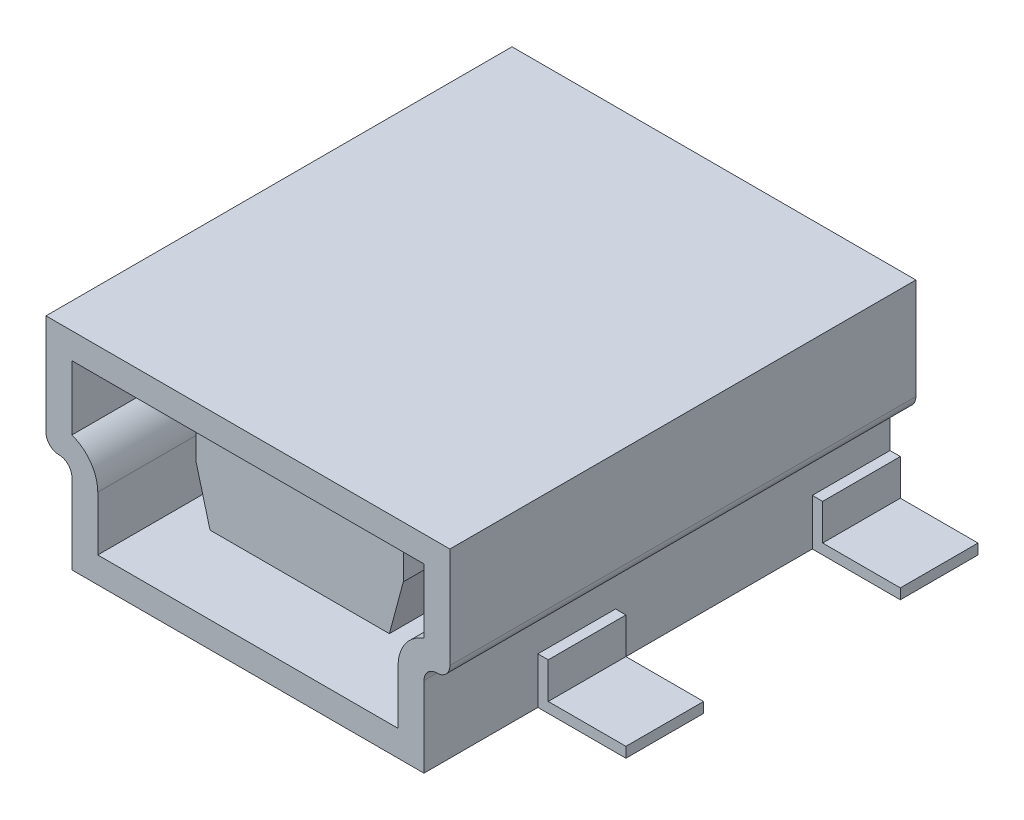
from build123d import *

# Parameters (mm, degrees)
SKETCH_1_W          = 7.8
SKETCH_1_H          = 4
EXTRUDE_1_DEPTH     = 9
SKETCH_2_W          = 0.5
SKETCH_2_H          = 9
CUT_EXTRUDE_1_DEPTH = 1.8
FILLET_START        = -1
FILLET_1_DEPTH      = 11
FILLET_1_2_DEPTH    = 9
SHELL_1_T           = -0.5
SKETCH_3_W          = 4
SKETCH_3_H          = 1.5
EXTRUDE_2_DEPTH     = 7.5
CHAMFER_1_SIZE      = 1
CHAMFER_1_SIZE2     = 0.267949192
CHAMFER_2_SIZE      = 1
CHAMFER_2_SIZE2     = 0.267949192
SKETCH_4_W          = 1.5
SKETCH_4_H          = 0.896951392
EXTRUDE_3_DEPTH     = 0.2
SKETCH_5_W          = 1.5
SKETCH_5_H          = 0.2
EXTRUDE_4_DEPTH     = 1.5


with BuildPart() as part:
    # 草图1 → 拉伸1 (new body)
    with BuildSketch(Plane.XY):
        Rectangle(SKETCH_1_W, SKETCH_1_H)
    extrude(amount=EXTRUDE_1_DEPTH)

    # 草图2 → 切除-拉伸1 (cut)
    with BuildSketch(Plane.XZ.offset(2)):
        with Locations((-3.65, 4.5)):
            Rectangle(SKETCH_2_W, SKETCH_2_H)
        with Locations((3.65, 4.5)):
            Rectangle(SKETCH_2_W, SKETCH_2_H)
    extrude(amount=-CUT_EXTRUDE_1_DEPTH, mode=Mode.SUBTRACT)

    # 圆角1: read off the stored shape, not the designer's step
    # 圆角1 outline → 圆角1 (cut)
    with BuildSketch(Plane.XY.offset(FILLET_START)):
        with BuildLine():
            ThreePointArc((3.9, 0.05), (3.826776695, -0.126776695), (3.65, -0.2))
            Line((3.65, -0.2), (3.9, -0.2))
            Line((3.9, -0.2), (3.9, 0.05))
        make_face()
        with BuildLine():
            ThreePointArc((-3.65, -0.2), (-3.826776695, -0.126776695), (-3.9, 0.05))
            Line((-3.9, 0.05), (-3.9, -0.2))
            Line((-3.9, -0.2), (-3.65, -0.2))
        make_face()
    extrude(amount=FILLET_1_DEPTH, mode=Mode.SUBTRACT)

    # Fillet 1 2 outline → Fillet 1 2 (add)
    with BuildSketch(Plane.XY):
        with BuildLine():
            Line((3.4, -0.2), (3.4, -0.45))
            ThreePointArc((3.4, -0.45), (3.473223305, -0.273223305), (3.65, -0.2))
            Line((3.65, -0.2), (3.4, -0.2))
        make_face()
        with BuildLine():
            Line((-3.4, -0.2), (-3.65, -0.2))
            ThreePointArc((-3.65, -0.2), (-3.473223305, -0.273223305), (-3.4, -0.45))
            Line((-3.4, -0.45), (-3.4, -0.2))
        make_face()
    extrude(amount=FILLET_1_2_DEPTH)

    # 抽壳1
    shell_1_openings = [part.faces().sort_by_distance(p)[0] for p in [
        (0, 0.067245036, 9),
    ]]
    offset(amount=SHELL_1_T, openings=shell_1_openings, kind=Kind.INTERSECTION)

    # 草图3 → 拉伸2 (add)
    with BuildSketch(Plane.XY.offset(0.5)):
        with Locations((0, -0.25)):
            Rectangle(SKETCH_3_W, SKETCH_3_H)
    extrude(amount=EXTRUDE_2_DEPTH)

    # 倒角1
    chamfer_1_edges = [part.edges().sort_by_distance(p)[0] for p in [
        (-2, -1, 4.25),
    ]]
    chamfer_1_side = [part.faces().sort_by_distance(p)[0] for p in [
        (-2, -0.25, 4.25),
    ]]
    chamfer(chamfer_1_edges, length=CHAMFER_1_SIZE, length2=CHAMFER_1_SIZE2, reference=chamfer_1_side[0])

    # 倒角2
    chamfer_2_edges = [part.edges().sort_by_distance(p)[0] for p in [
        (2, -1, 4.25),
    ]]
    chamfer_2_side = [part.faces().sort_by_distance(p)[0] for p in [
        (2, -0.25, 4.25),
    ]]
    chamfer(chamfer_2_edges, length=CHAMFER_2_SIZE, length2=CHAMFER_2_SIZE2, reference=chamfer_2_side[0])

    # 草图4 → 拉伸3 (add)
    with BuildSketch(Plane(origin=(3.4, 0, 0), x_dir=(0, 0, -1), z_dir=(1, 0, 0))):
        with Locations((-6.05, -1.551524304)):
            Rectangle(SKETCH_4_W, SKETCH_4_H)
        with Locations((-0.75, -1.551524304)):
            Rectangle(SKETCH_4_W, SKETCH_4_H)
    extrude_3 = extrude(amount=EXTRUDE_3_DEPTH)

    # 镜向1: 拉伸3 across plane
    add(extrude_3.mirror(Plane(origin=(0, 0, 0), x_dir=(0, 0, 1), z_dir=(1, 0, 0))))

    # 草图5 → 拉伸4 (add)
    with BuildSketch(Plane(origin=(3.6, 0, 0), x_dir=(0, 0, -1), z_dir=(1, 0, 0))):
        with Locations((-6.05, -1.9)):
            Rectangle(SKETCH_5_W, SKETCH_5_H)
        with Locations((-0.75, -1.9)):
            Rectangle(SKETCH_5_W, SKETCH_5_H)
    extrude_4 = extrude(amount=EXTRUDE_4_DEPTH)

    # 镜向2: 拉伸4 across plane
    add(extrude_4.mirror(Plane(origin=(0, 0, 0), x_dir=(0, 0, 1), z_dir=(1, 0, 0))))


solid = part.part
